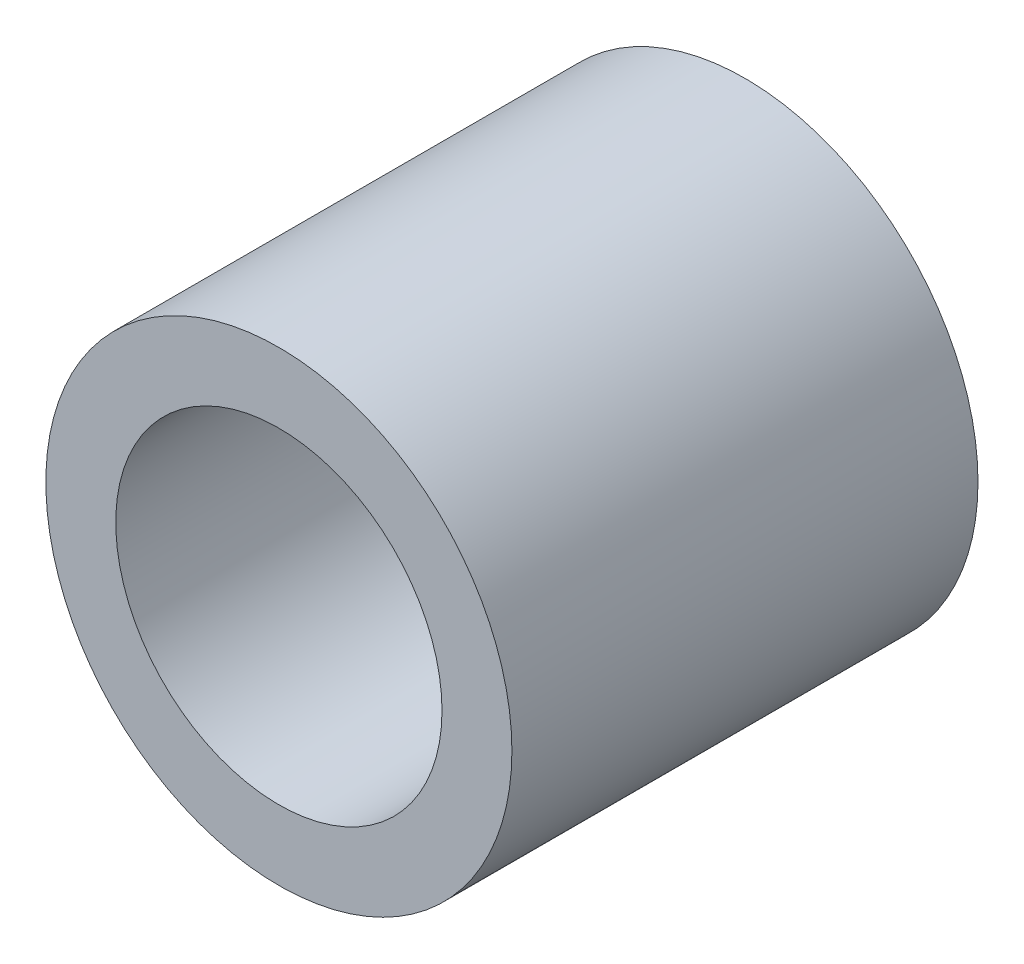
from build123d import *

# Parameters (mm, degrees)
SKETCH1_R           = 6.35
SKETCH1_R_2         = 4.445
BOSS_EXTRUDE1_DEPTH = 6.35


with BuildPart() as part:
    # Sketch1 → Boss-Extrude1 (new, symmetric)
    with BuildSketch(Plane.XY):
        Circle(SKETCH1_R)
        Circle(SKETCH1_R_2, mode=Mode.SUBTRACT)
    extrude(amount=BOSS_EXTRUDE1_DEPTH, both=True)


solid = part.part
